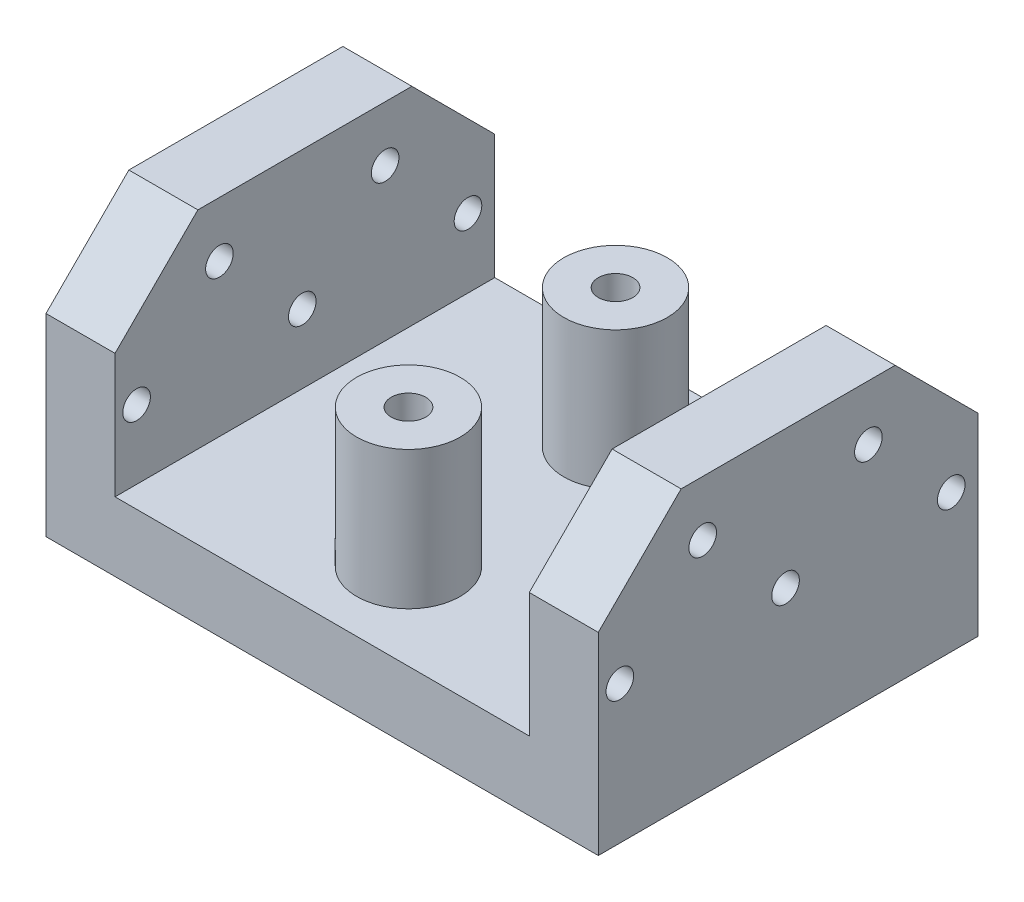
from build123d import *

# Parameters (mm, degrees)
SKETCH1_W           = 80
SKETCH1_H           = 55
BOSS_EXTRUDE1_DEPTH = 10
SKETCH2_W           = 10
SKETCH2_H           = 55
BOSS_EXTRUDE2_DEPTH = 30
SKETCH3_R           = 2
CUT_EXTRUDE1_DEPTH  = 94.574836361
SKETCH4_R           = 2.5
CUT_EXTRUDE2_DEPTH  = 30
SKETCH5_R           = 7.5
SKETCH5_R_2         = 2.5
BOSS_EXTRUDE3_DEPTH = 20
SKETCH6_W           = 20.5
SKETCH6_H           = 3.25
CUT_EXTRUDE3_DEPTH  = 5
CUT_EXTRUDE4_DEPTH  = 94.574836361


with BuildPart() as part:
    # Sketch1 → Boss-Extrude1 (new body)
    with BuildSketch(Plane(origin=(0, 0, 0), x_dir=(1, 0, 0), z_dir=(0, 1, 0))):
        Rectangle(SKETCH1_W, SKETCH1_H)
    extrude(amount=BOSS_EXTRUDE1_DEPTH)

    # Sketch2 → Boss-Extrude2 (add)
    with BuildSketch(Plane(origin=(0, 10, 0), x_dir=(1, 0, 0), z_dir=(0, 1, 0))):
        with Locations((-35, 0)):
            Rectangle(SKETCH2_W, SKETCH2_H)
        with Locations((35, 0)):
            Rectangle(SKETCH2_W, SKETCH2_H)
    extrude(amount=BOSS_EXTRUDE2_DEPTH)

    # Sketch3 → Cut-Extrude1 (cut, through all)
    with BuildSketch(Plane.ZY.offset(40)):
        with Locations((-23.624192801, 20)):
            Circle(SKETCH3_R)
        with Locations((0.375807199, 20)):
            Circle(SKETCH3_R)
        with Locations((24.375807199, 20)):
            Circle(SKETCH3_R)
        with Locations((-11.624192801, 32)):
            Circle(SKETCH3_R)
        with Locations((12.375807199, 32)):
            Circle(SKETCH3_R)
    extrude(amount=-CUT_EXTRUDE1_DEPTH, mode=Mode.SUBTRACT)

    # Sketch4 → Cut-Extrude2 (cut)
    with BuildSketch(Plane.XZ):
        with Locations((0, 15)):
            Circle(SKETCH4_R)
        with Locations((0, -15)):
            Circle(SKETCH4_R)
    extrude(amount=-CUT_EXTRUDE2_DEPTH, mode=Mode.SUBTRACT)

    # Sketch5 → Boss-Extrude3 (add)
    # profile 1 of 2: a face of its own
    with BuildSketch(Plane(origin=(0, 10, 0), x_dir=(1, 0, 0), z_dir=(0, 1, 0))):
        with Locations((0, 15)):
            Circle(SKETCH5_R)
        with Locations((0, 15)):
            Circle(SKETCH5_R_2, mode=Mode.SUBTRACT)
    # profile 2 of 2: a face of its own
    with BuildSketch(Plane(origin=(0, 10, 0), x_dir=(1, 0, 0), z_dir=(0, 1, 0))):
        with Locations((0, -15)):
            Circle(SKETCH5_R)
        with Locations((0, -15)):
            Circle(SKETCH5_R_2, mode=Mode.SUBTRACT)
    extrude(amount=BOSS_EXTRUDE3_DEPTH)

    # Sketch6 → Cut-Extrude3 (cut)
    with BuildSketch(Plane.XZ):
        with Locations((0, 9.125)):
            Rectangle(SKETCH6_W, SKETCH6_H)
        with Locations((0, -9.125)):
            Rectangle(SKETCH6_W, SKETCH6_H)
    extrude(amount=-CUT_EXTRUDE3_DEPTH, mode=Mode.SUBTRACT)

    # Sketch7 → Cut-Extrude4 (cut, through all)
    with BuildSketch(Plane(origin=(40, 0, 0), x_dir=(0, 0, -1), z_dir=(1, 0, 0))):
        Polygon((-27.5, 28), (-15.5, 40), (-27.5, 40), align=None)
        Polygon((15.5, 40), (27.5, 28), (27.5, 40), align=None)
    extrude(amount=-CUT_EXTRUDE4_DEPTH, mode=Mode.SUBTRACT)


solid = part.part
